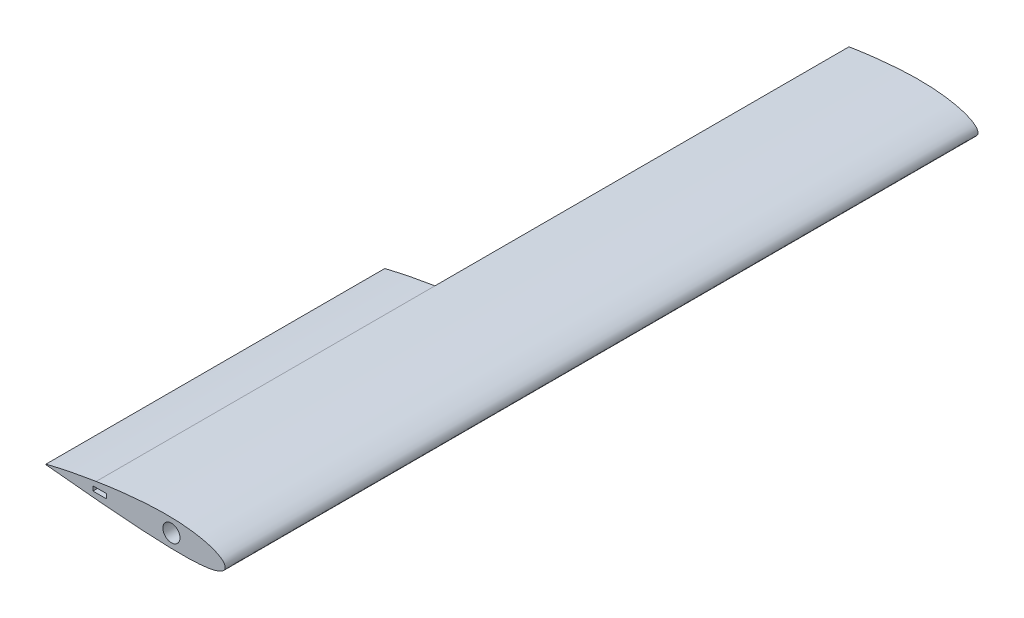
from build123d import *

# Parameters (mm, degrees)
BOSS_EXTRUDE1_DEPTH = 1120
BOSS_EXTRUDE2_DEPTH = 504
SKETCH3_R           = 12.7
CUT_EXTRUDE1_DEPTH  = 801
SKETCH4_W           = 32
SKETCH4_H           = 36.699
CUT_EXTRUDE2_DEPTH  = 46
SKETCH5_W           = 60
SKETCH5_H           = 12
CUT_EXTRUDE3_DEPTH  = 46
SKETCH6_W           = 54
SKETCH6_H           = 29.1
CUT_EXTRUDE4_DEPTH  = 64
SKETCH7_W           = 20.4
SKETCH7_H           = 6.8
CUT_EXTRUDE5_DEPTH  = 26
SKETCH8_W           = 20
SKETCH8_H           = 4
CUT_EXTRUDE6_DEPTH  = 20


with BuildPart() as part:
    # Sketch1 → Boss-Extrude1 (new body)
    with BuildSketch(Plane.XY):
        with BuildLine():
            Line((-191.93544, 15.415994386), (-191.93544, -7.690938633))
            add(Edge.make_bspline(
                [(-191.93544, 15.415994386), (-189.524263645, 15.800399619), (-183.840015022, 16.706619074), (-174.781136721, 18.029343411), (-164.699001073, 19.401069917), (-154.413191944, 20.673735856), (-143.988170783, 21.830432901), (-133.488738685, 22.849158456), (-122.980748105, 23.710765794), (-112.515417187, 24.396095093), (-102.139321575, 24.893723734), (-91.916475809, 25.125832859), (-81.930286803, 25.090046311), (-72.266831195, 24.780871286), (-62.991070612, 24.200812347), (-54.165224939, 23.356898581), (-45.848172705, 22.261450678), (-38.094792214, 20.931595824), (-30.955366589, 19.388795281), (-24.475027042, 17.658061869), (-18.693227651, 15.766937372), (-13.643188102, 13.744216819), (-9.351263596, 11.618189035), (-5.83608943, 9.414274451), (-3.108519117, 7.149904568), (-1.175256134, 4.827939872), (-0.063283786, 2.426466328), (0.145020659, -0.01456545), (-0.541831171, -2.364092475), (-2.092939689, -4.498687379), (-4.413682401, -6.404391962), (-7.476250194, -8.116874818), (-11.268094049, -9.647026376), (-15.771581276, -10.99526881), (-20.962122659, -12.158099265), (-26.809437569, -13.132372723), (-33.278882983, -13.916792281), (-40.332337427, -14.512824611), (-47.92878569, -14.925150527), (-56.024697843, -15.161881697), (-64.574273602, -15.234523302), (-73.529599748, -15.15778324), (-82.840735601, -14.948927871), (-92.455830845, -14.627964828), (-102.340307767, -14.21298414), (-112.453303072, -13.731946661), (-122.732635144, -13.141710162), (-133.097571213, -12.46700742), (-143.470724362, -11.725475749), (-153.789329166, -10.934787918), (-163.990582264, -10.110993441), (-174.011944986, -9.267782762), (-183.307195894, -8.462466506), (-189.254313127, -7.930681979), (-191.93544, -7.690938633)],
                knots=[0, 0, 0, 0, 0.018424224, 0.043434346, 0.069080412, 0.095203092, 0.121640117, 0.148227444, 0.17480049, 0.201195447, 0.227363977, 0.253181792, 0.278347264, 0.302710399, 0.326128333, 0.348466602, 0.369600377, 0.389415723, 0.407811011, 0.424698681, 0.44000774, 0.453687637, 0.465714725, 0.476103672, 0.484928355, 0.492360154, 0.498730164, 0.504586951, 0.510443348, 0.516803825, 0.524198712, 0.532940661, 0.543185695, 0.554995644, 0.568376342, 0.583298542, 0.599709376, 0.617538825, 0.636703502, 0.65710892, 0.678650912, 0.701216586, 0.724685048, 0.748928058, 0.7738107, 0.799337901, 0.825325561, 0.851504471, 0.877716004, 0.903800001, 0.929595993, 0.954944401, 0.979687675, 1, 1, 1, 1], degree=3))
        make_face()
    extrude(amount=-BOSS_EXTRUDE1_DEPTH)

    # Sketch2 → Boss-Extrude2 (add)
    with BuildSketch(Plane.XY):
        with BuildLine():
            Line((-191.93544, 15.415994386), (-191.93544, -7.690938633))
            add(Edge.make_bspline(
                [(-191.93544, -7.690938633), (-192.420067172, -7.6478653), (-195.9504722, -7.334085307), (-202.385866532, -6.745023127), (-211.084168938, -5.940242123), (-219.309262382, -5.164593786), (-227.009250337, -4.427029261), (-234.135069499, -3.733617005), (-240.641108781, -3.090727292), (-246.485492948, -2.504721286), (-251.630355092, -1.980998465), (-256.042317782, -1.52735928), (-259.692220923, -1.143575748), (-262.556904408, -0.849913682), (-264.61546863, -0.612861211), (-265.858416096, -0.512805201), (-266.419029816, -0.418366575), (-266.567688701, -0.418895711), (-266.577, -0.418928854)],
                knots=[0, 0, 0, 0, 0.019462551, 0.14178051, 0.258505433, 0.368899529, 0.472261554, 0.567931303, 0.655293986, 0.733784513, 0.802891701, 0.862162346, 0.911205133, 0.949694244, 0.977372582, 0.994054454, 0.999627599, 1, 1, 1, 1], degree=3))
            Line((-266.577, -0.418928854), (-266.577, 0.425749675))
            add(Edge.make_bspline(
                [(-191.93544, 15.415994386), (-192.694105371, 15.297158223), (-196.500358816, 14.700952606), (-203.197962323, 13.562133744), (-211.868350415, 12.032890384), (-220.046599382, 10.510140605), (-227.684988534, 9.024362583), (-234.737630839, 7.595296544), (-241.162808355, 6.244967863), (-246.922671439, 4.994207922), (-251.983535359, 3.863075388), (-256.315994157, 2.870269248), (-259.895031117, 2.032695697), (-262.700108492, 1.365039114), (-264.715189952, 0.879184388), (-265.919534871, 0.586380331), (-266.450919413, 0.456553449), (-266.577, 0.425749675)],
                knots=[0, 0, 0, 0, 0.030251696, 0.151773928, 0.267626296, 0.377089872, 0.479484952, 0.574174897, 0.660569789, 0.738129949, 0.806369318, 0.864858701, 0.913228834, 0.951173208, 0.978450569, 0.994887008, 1, 1, 1, 1], degree=3))
        make_face()
    extrude(amount=-BOSS_EXTRUDE2_DEPTH)

    # Sketch3 → Cut-Extrude1 (cut)
    with BuildSketch(Plane.XY):
        with Locations((-79.973, 4.998)):
            Circle(SKETCH3_R)
    extrude(amount=-CUT_EXTRUDE1_DEPTH, mode=Mode.SUBTRACT)

    # Sketch4 → Cut-Extrude2 (cut)
    with BuildSketch(Plane.XY.offset(-376.7)):
        with Locations((-79.973, 2.3485)):
            Rectangle(SKETCH4_W, SKETCH4_H)
    extrude(amount=CUT_EXTRUDE2_DEPTH, mode=Mode.SUBTRACT)

    # Sketch5 → Cut-Extrude3 (cut)
    with BuildSketch(Plane.XY.offset(-376.7)):
        with Locations((-213.2616, -1.779)):
            Rectangle(SKETCH5_W, SKETCH5_H)
    extrude(amount=CUT_EXTRUDE3_DEPTH, mode=Mode.SUBTRACT)

    # Sketch6 → Cut-Extrude4 (cut)
    with BuildSketch(Plane.XY.offset(-598.5)):
        with Locations((-146.617, 0.046)):
            Rectangle(SKETCH6_W, SKETCH6_H)
    extrude(amount=CUT_EXTRUDE4_DEPTH, mode=Mode.SUBTRACT)

    # Sketch7 → Cut-Extrude5 (cut)
    with BuildSketch(Plane.XY.offset(-25.5)):
        with Locations((-186.604, 3.999)):
            Rectangle(SKETCH7_W, SKETCH7_H)
    extrude(amount=CUT_EXTRUDE5_DEPTH, mode=Mode.SUBTRACT)

    # Sketch8 → Cut-Extrude6 (cut)
    with BuildSketch(Plane.XY.offset(-930)):
        with Locations((-50, -14.17)):
            Rectangle(SKETCH8_W, SKETCH8_H)
    extrude(amount=CUT_EXTRUDE6_DEPTH, mode=Mode.SUBTRACT)


solid = part.part
